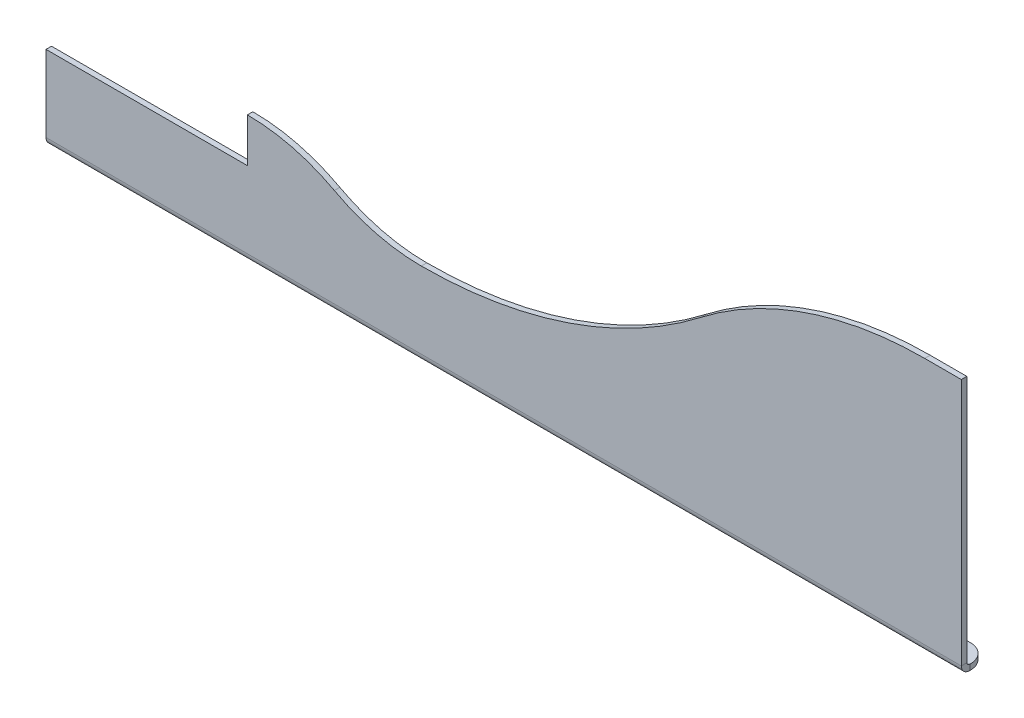
from build123d import *

# Parameters (mm, degrees)
BASIS_BLECH1_DEPTH              = 3
KANTE_LASCHE1_STRIP_W           = 15
KANTE_LASCHE1_STRIP_H           = 3
KANTE_LASCHE1_STRIP_CUT_DEPTH   = 500
KANTE_LASCHE1_DEPTH             = 500
SKIZZE19_R                      = 3.1
SCHNITT_LINEAR_AUSTRAGEN2_DEPTH = 519.20277279
SCHNITT_LINEAR_AUSTRAGEN3_DEPTH = 519.20277279
VERRUNDUNG1_R                   = 10


# Sheet-metal steps are written as plain solids
with BuildPart() as part:
    # Skizze9 → Basis-Blech1 (new body)
    with BuildSketch(Plane.XY):
        with BuildLine():
            Line((-4.107759965, 21.019858626), (495.892240035, 21.019858626))
            Line((495.892240035, 21.019858626), (495.892240035, 161.019858626))
            Line((495.892240035, 161.019858626), (475.892240035, 161.019858626))
            ThreePointArc((475.892240035, 161.019858626), (411.323644717, 150.310366837), (353.670017813, 119.328823613))
            ThreePointArc((353.670017813, 119.328823613), (281.602984183, 80.601894582), (200.892240035, 67.215029846))
            ThreePointArc((200.892240035, 67.215029846), (176.395892893, 70.261798973), (153.392240035, 79.216450312))
            ThreePointArc((153.392240035, 79.216450312), (130.388587177, 88.171101651), (105.892240035, 91.217870778))
            Line((105.892240035, 91.217870778), (105.892240035, 67.215029846))
            Line((105.892240035, 67.215029846), (-4.107759965, 67.215029846))
            Line((-4.107759965, 67.215029846), (-4.107759965, 21.019858626))
        make_face()
    extrude(amount=-BASIS_BLECH1_DEPTH)

    # Kante-Lasche1 strip (across the edge) → Kante-Lasche1 strip cut (cut)
    with BuildSketch(Plane(origin=(495.892240035, 21.019858626, -3), x_dir=(0, 1, 0), z_dir=(-1, 0, 0))):
        with Locations((-3, -1.5)):
            Rectangle(KANTE_LASCHE1_STRIP_W, KANTE_LASCHE1_STRIP_H)
    extrude(amount=KANTE_LASCHE1_STRIP_CUT_DEPTH, mode=Mode.SUBTRACT)

    # Kante-Lasche1 section (across the edge) → Kante-Lasche1 (add)
    with BuildSketch(Plane(origin=(495.892240035, 21.019858626, -3), x_dir=(0, 1, 0), z_dir=(-1, 0, 0))):
        with BuildLine():
            Line((0, 1.5), (0, 52))
            Line((0, 52), (3, 52))
            Line((3, 52), (3, 1.5))
            ThreePointArc((3, 1.5), (3.439339828, 0.439339828), (4.5, 0))
            Line((4.5, 0), (4.5, -3))
            ThreePointArc((4.5, -3), (1.318019485, -1.681980515), (0, 1.5))
        make_face()
    extrude(amount=KANTE_LASCHE1_DEPTH)

    # Skizze19 → Schnitt-Linear austragen2 (cut, through all)
    with BuildSketch(Plane.XZ.offset(-21.019858626)):
        with Locations(Location((263.569909565, -12.07233047, 0), (0, 0, 270))):
            Circle(SKIZZE19_R)
        with Locations(Location((228.214570506, -12.07233047, 0), (0, 0, 270))):
            Circle(SKIZZE19_R)
        with Locations(Location((263.569909565, -47.42766953, 0), (0, 0, 270))):
            Circle(SKIZZE19_R)
        with Locations(Location((228.214570506, -47.42766953, 0), (0, 0, 270))):
            Circle(SKIZZE19_R)
    extrude(amount=-SCHNITT_LINEAR_AUSTRAGEN2_DEPTH, mode=Mode.SUBTRACT)

    # Skizze21 → Schnitt-Linear austragen3 (cut, through all)
    with BuildSketch(Plane.XZ.offset(-21.019858626)):
        with BuildLine():
            Line((-4.107759965, -55), (-4.107759965, -15))
            Line((-4.107759965, -15), (183.53156026, -15))
            ThreePointArc((183.53156026, -15), (194.046182503, -17.986983833), (201.42010408, -26.05572809))
            Line((201.42010408, -26.05572809), (215.892240035, -55))
            Line((215.892240035, -55), (-4.107759965, -55))
        make_face()
        with BuildLine():
            Line((275.892240035, -55), (495.892240035, -55))
            Line((495.892240035, -55), (495.892240035, -15))
            Line((495.892240035, -15), (308.25291981, -15))
            ThreePointArc((308.25291981, -15), (297.738297568, -17.986983833), (290.36437599, -26.05572809))
            Line((290.36437599, -26.05572809), (275.892240035, -55))
        make_face()
    extrude(amount=-SCHNITT_LINEAR_AUSTRAGEN3_DEPTH, mode=Mode.SUBTRACT)

    # Verrundung1
    verrundung1_edges = [part.edges().sort_by_distance(p)[0] for p in [
        (275.892240035, 22.519858626, -55),
        (215.892240035, 22.519858626, -55),
        (-4.107759965, 22.519858626, -15),
        (495.892240035, 22.519858626, -15),
    ]]
    fillet(verrundung1_edges, radius=VERRUNDUNG1_R)


solid = part.part
